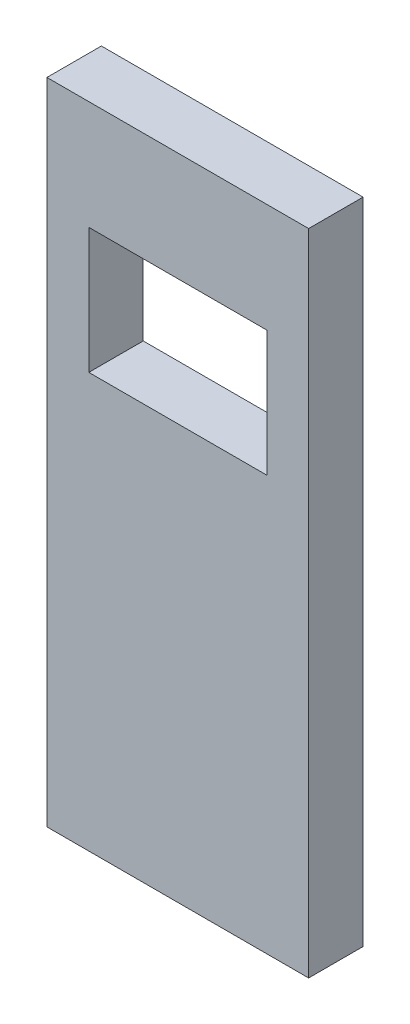
from build123d import *

# Parameters (mm, degrees)
SKETCH1_W           = 17
SKETCH1_H           = 12
BOSS_EXTRUDE1_DEPTH = 2.6


with BuildPart() as part:
    # Sketch1 → Boss-Extrude1 (new, symmetric)
    with BuildSketch(Plane.XY):
        Polygon((0, 62), (0, 39.6), (0, 34.4), (0, 22.4), (0, 17.2), (0, 0), (25, 0), (25, 17.2), (25, 22.4), (25, 34.4), (25, 39.6), (25, 62), align=None)
        with Locations((12.5, 45.6)):
            Rectangle(SKETCH1_W, SKETCH1_H, mode=Mode.SUBTRACT)
    extrude(amount=BOSS_EXTRUDE1_DEPTH, both=True)


solid = part.part
